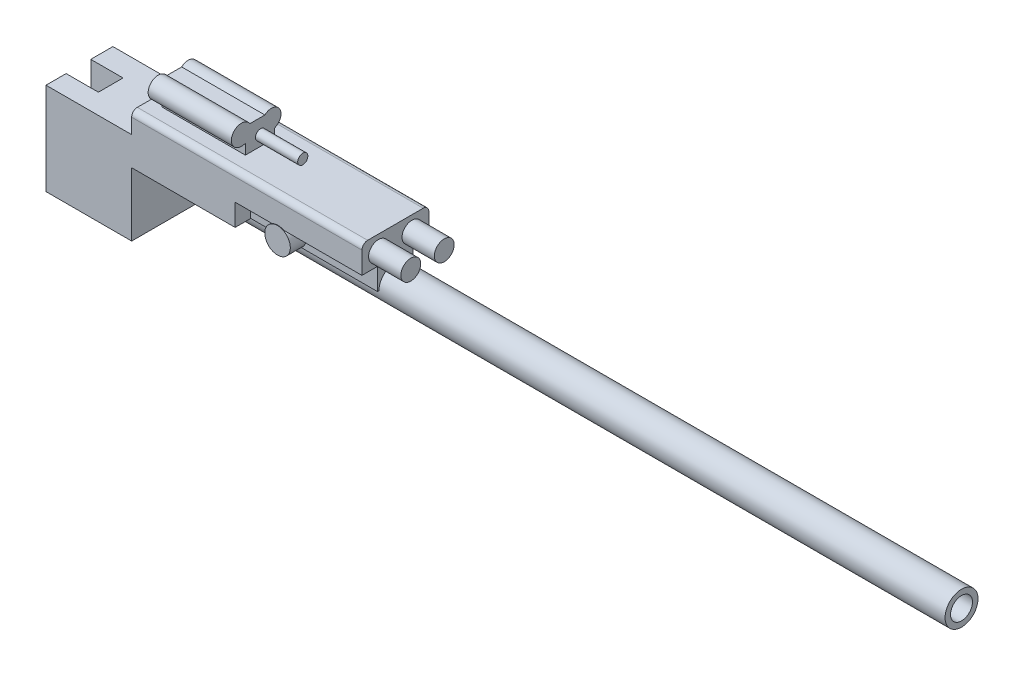
from build123d import *

# Parameters (mm, degrees)
BOSS_EXTRUDE1_DEPTH = 1177.5
SKETCH7_W           = 2355
SKETCH7_H           = 1740.555085097
BOSS_EXTRUDE2_DEPTH = 8106
FILLET1_R           = 200
SKETCH8_R           = 580
SKETCH8_R_2         = 386.155446834
BOSS_EXTRUDE3_DEPTH = 28036
BOSS_EXTRUDE4_DEPTH = 2929
SKETCH11_R          = 178.501353542
BOSS_EXTRUDE5_DEPTH = 1487
SKETCH12_R          = 350
BOSS_EXTRUDE6_DEPTH = 1136
SKETCH13_W          = 867.802834768
SKETCH13_H          = 3575.677085012
CUT_EXTRUDE1_DEPTH  = 1136
SKETCH14_W          = 549.911139509
SKETCH14_H          = 770.277542548
CUT_EXTRUDE2_DEPTH  = 4464
SKETCH16_R          = 450
BOSS_EXTRUDE8_DEPTH = 566
SCALE1_SCALE        = 0.1


with BuildPart() as part:
    # Sketch4 → Boss-Extrude1 (new, symmetric)
    with BuildSketch(Plane.XY):
        Polygon((3015.740804755, 1433.316683759), (3015.740804755, 3245.242187391), (0, 3245.242187391), (0, 0), (3015.740804755, 0), align=None)
    extrude(amount=BOSS_EXTRUDE1_DEPTH, both=True)

    # Sketch7 → Boss-Extrude2 (add)
    with BuildSketch(Plane(origin=(3015.740804755, 0, 0), x_dir=(0, 0, -1), z_dir=(1, 0, 0))):
        with Locations((0, 3107.092216472)):
            Rectangle(SKETCH7_W, SKETCH7_H)
    extrude(amount=BOSS_EXTRUDE2_DEPTH)

    # Fillet1
    fillet1_edges = [part.edges().sort_by_distance(p)[0] for p in [
        (7068.740804755, 3977.36975902, -1177.5),
        (7068.740804755, 3977.36975902, 1177.5),
    ]]
    fillet(fillet1_edges, radius=FILLET1_R)

    # Sketch8 → Boss-Extrude3 (add)
    with BuildSketch(Plane(origin=(3015.740804755, 0, 0), x_dir=(0, 0, -1), z_dir=(1, 0, 0))):
        with Locations((0, 2236.814673923)):
            Circle(SKETCH8_R)
        with Locations((0, 2236.814673923)):
            Circle(SKETCH8_R_2, mode=Mode.SUBTRACT)
    extrude(amount=BOSS_EXTRUDE3_DEPTH)

    # Sketch10 → Boss-Extrude4 (add)
    with BuildSketch(Plane.ZY.offset(-3445.740804755)):
        with BuildLine():
            ThreePointArc((533.50097365, 4343.525307577), (1011.246801233, 4772.830154673), (374.798556427, 4859.301879511))
            Line((374.798556427, 4859.301879511), (-152.662089581, 4859.301879511))
            ThreePointArc((-152.662089581, 4859.301879511), (-672.248903181, 4783.665414028), (-490.686018908, 4290.992854581))
            Line((-490.686018908, 4290.992854581), (-490.686018908, 3977.36975902))
            Line((-490.686018908, 3977.36975902), (533.50097365, 3977.36975902))
            Line((533.50097365, 3977.36975902), (533.50097365, 4343.525307577))
        make_face()
    extrude(amount=-BOSS_EXTRUDE4_DEPTH)

    # Sketch11 → Boss-Extrude5 (add)
    with BuildSketch(Plane(origin=(6374.740804755, 0, 0), x_dir=(0, 0, -1), z_dir=(1, 0, 0))):
        with Locations((0, 4336.597341004)):
            Circle(SKETCH11_R)
    extrude(amount=BOSS_EXTRUDE5_DEPTH)

    # Sketch12 → Boss-Extrude6 (add)
    with BuildSketch(Plane(origin=(11121.740804755, 0, 0), x_dir=(0, 0, -1), z_dir=(1, 0, 0))):
        with Locations((-593.154838159, 3459.12910761)):
            Circle(SKETCH12_R)
        with Locations((583.821506247, 3459.12910761)):
            Circle(SKETCH12_R)
    extrude(amount=BOSS_EXTRUDE6_DEPTH)

    # Sketch13 → Cut-Extrude1 (cut)
    with BuildSketch(Plane.ZY):
        with Locations((35.141374289, 1787.838542506)):
            Rectangle(SKETCH13_W, SKETCH13_H)
    extrude(amount=-CUT_EXTRUDE1_DEPTH, mode=Mode.SUBTRACT)

    # Sketch14 → Cut-Extrude2 (cut)
    with BuildSketch(Plane(origin=(11121.740804755, 0, 0), x_dir=(0, 0, -1), z_dir=(1, 0, 0))):
        with Locations((-902.544430246, 2621.953445197)):
            Rectangle(SKETCH14_W, SKETCH14_H)
        with Locations((902.544430246, 2621.953445197)):
            Rectangle(SKETCH14_W, SKETCH14_H)
    extrude(amount=-CUT_EXTRUDE2_DEPTH, mode=Mode.SUBTRACT)

    # Sketch16 → Boss-Extrude8 (add)
    with BuildSketch(Plane.XY.offset(627.588860491)):
        with Locations((8166.722045468, 2606.020907823)):
            Circle(SKETCH16_R)
    boss_extrude8 = extrude(amount=BOSS_EXTRUDE8_DEPTH)

    # Mirror1: Boss-Extrude8 across plane
    add(boss_extrude8.mirror(Plane.XY))


with BuildPart() as part_1:
    # Scale1: scaled about (0, 0, 0)
    add(part.part.scale(SCALE1_SCALE))


solid = part_1.part
